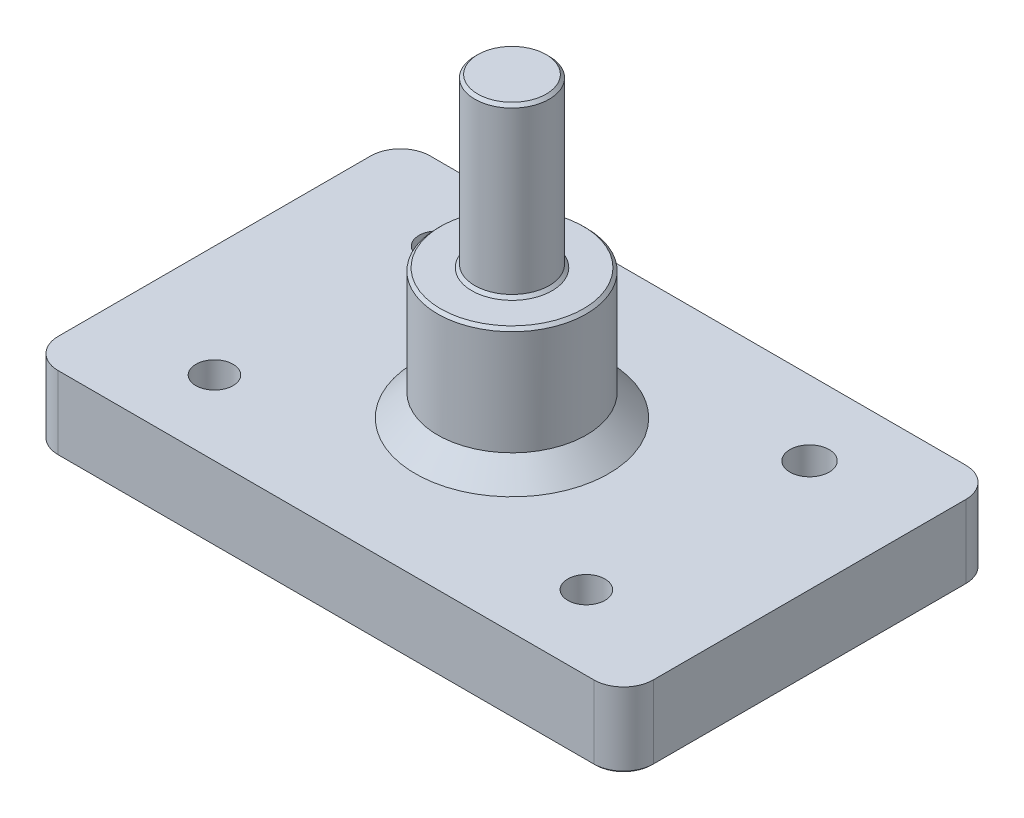
from build123d import *

# Parameters (mm, degrees)
SKETCH1_W           = 101.6
SKETCH1_H           = 63.5
SKETCH1_R           = 3.175
SKETCH1_R_2         = 3.349234597
BOSS_EXTRUDE1_DEPTH = 12.7
SKETCH2_R           = 12.7
BOSS_EXTRUDE2_DEPTH = 50.8
CHAMFER1_SIZE       = 3.81
FILLET1_R           = 5.08
CHAMFER2_SIZE       = 0.254
CUT_EXTRUDE1_START  = -28.575
SKETCH3_R           = 12.7
SKETCH3_R_2         = 6.35
CUT_EXTRUDE1_DEPTH  = 28.575
CHAMFER3_SIZE       = 0.508


with BuildPart() as part:
    # Sketch1 → Boss-Extrude1 (new body)
    with BuildSketch(Plane(origin=(0, 0, 0), x_dir=(1, 0, 0), z_dir=(0, 1, 0))):
        Rectangle(SKETCH1_W, SKETCH1_H)
        with Locations((-31.75, 19.05)):
            Circle(SKETCH1_R, mode=Mode.SUBTRACT)
        with Locations((-31.75, -19.05)):
            Circle(SKETCH1_R, mode=Mode.SUBTRACT)
        with Locations((31.75, -19.05)):
            Circle(SKETCH1_R, mode=Mode.SUBTRACT)
        with Locations((31.75, 19.05)):
            Circle(SKETCH1_R_2, mode=Mode.SUBTRACT)
    extrude(amount=BOSS_EXTRUDE1_DEPTH)

    # Sketch2 → Boss-Extrude2 (add)
    with BuildSketch(Plane(origin=(0, 12.7, 0), x_dir=(1, 0, 0), z_dir=(0, 1, 0))):
        Circle(SKETCH2_R)
    extrude(amount=BOSS_EXTRUDE2_DEPTH)

    # Chamfer1
    chamfer1_edges = [part.edges().sort_by_distance(p)[0] for p in [
        (-12.7, 12.7, 0),
    ]]
    chamfer(chamfer1_edges, length=CHAMFER1_SIZE)

    # Fillet1
    fillet1_edges = [part.edges().sort_by_distance(p)[0] for p in [
        (-50.8, 6.35, 31.75),
        (50.8, 6.35, 31.75),
        (50.8, 6.35, -31.75),
        (-50.8, 6.35, -31.75),
    ]]
    fillet(fillet1_edges, radius=FILLET1_R)

    # Chamfer2
    chamfer2_edges = [part.edges().sort_by_distance(p)[0] for p in [
        (28.400765403, 0, -19.05),
        (-34.925, 0, -19.05),
        (49.312102448, 0, 30.262102448),
        (50.8, 0, 0),
        (49.312102448, 0, -30.262102448),
        (0, 0, -31.75),
        (-49.312102448, 0, -30.262102448),
        (-50.8, 0, 0),
        (-49.312102448, 0, 30.262102448),
        (0, 0, 31.75),
        (-34.925, 0, 19.05),
        (28.575, 0, 19.05),
    ]]
    chamfer(chamfer2_edges, length=CHAMFER2_SIZE)

    # Sketch3 → Cut-Extrude1 (cut)
    with BuildSketch(Plane(origin=(0, 63.5, 0), x_dir=(1, 0, 0), z_dir=(0, 1, 0)).offset(CUT_EXTRUDE1_START)):
        Circle(SKETCH3_R)
        Circle(SKETCH3_R_2, mode=Mode.SUBTRACT)
    extrude(amount=CUT_EXTRUDE1_DEPTH, mode=Mode.SUBTRACT)

    # Chamfer3
    chamfer3_edges = [part.edges().sort_by_distance(p)[0] for p in [
        (-6.35, 63.5, 0),
        (-12.7, 34.925, 0),
        (-6.35, 34.925, 0),
    ]]
    chamfer(chamfer3_edges, length=CHAMFER3_SIZE)


solid = part.part
